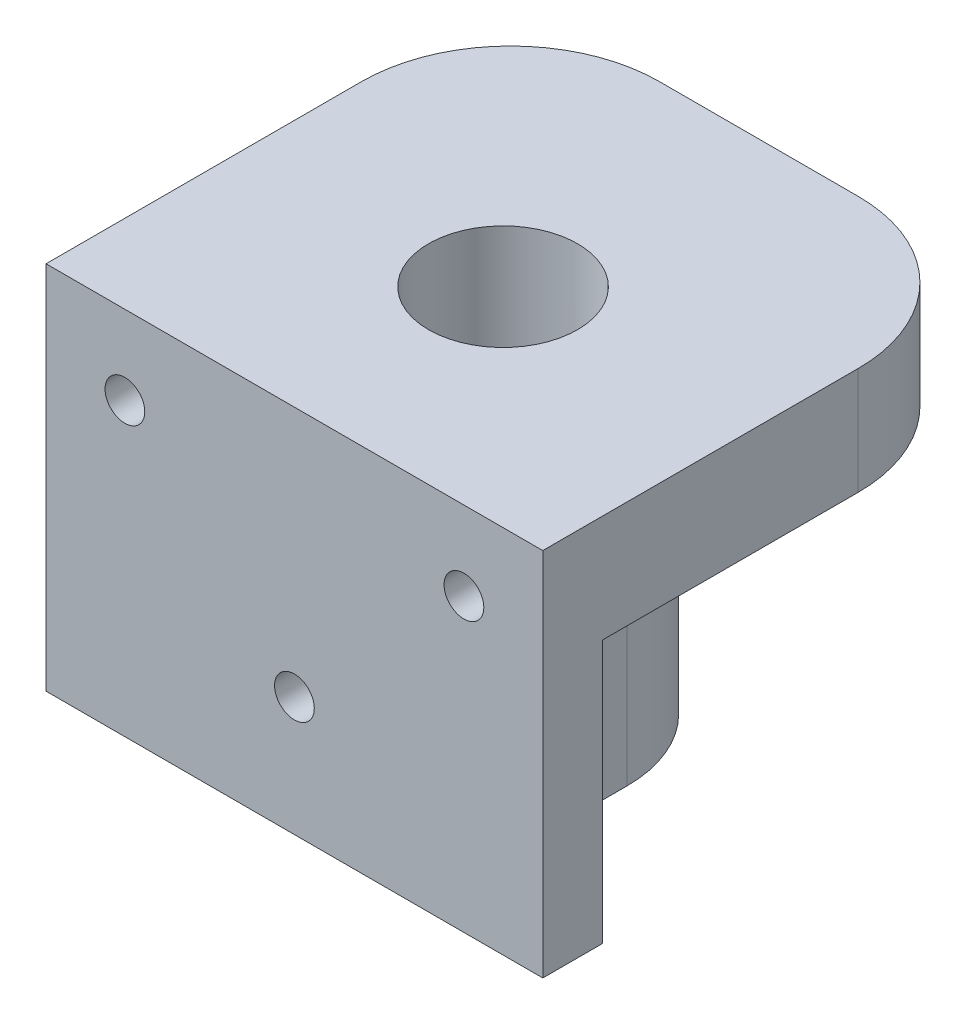
from build123d import *

# Parameters (mm, degrees)
PROFILE_SKETCH1_R                              = 7.5
PROFILE_BOSS_EXTRUDE2_DEPTH                    = 37.25987
FASTENINGHOLESKETCH3_R                         = 2
FASTENINGHOLECUT_EXTRUDE8_DEPTH                = 56.995963358
LM8UUFASTENINGHOLESKETCH5_R                    = 2
LM8UUFASTENINGHOLECUT_EXTRUDE9_DEPTH           = 56.995963425
TOPKNOTCHSKETCH2_W                             = 50
TOPKNOTCHSKETCH2_H                             = 27.5
TOPKNOTCHCUT_EXTRUDE1_DEPTH                    = 10.8
TOPSHELFSKETCH3_W                              = 50
TOPSHELFSKETCH3_H                              = 10.8
TOPSHELFBOSS_EXTRUDE1_DEPTH                    = 40.75
TOPSHELFLM8UUHOLESKETCH_R                      = 7.5
TOPSHELFLM8UUCUT_EXTRUDE2_DEPTH                = 52.733552168
FILLET3_R                                      = 15
FILLET4_R                                      = 15
RIGHTZAXISMICROSWITCHCUT_EXTRUDE1_DEPTH        = 12.05
RIGHTZAXISMICROSWITCHMOUNTINGHOLESKETCH3_R     = 1.5
RIGHTZAXISMICROSWITCHMOUNTINGHOLECUT_EXT_DEPTH = 3.1


with BuildPart() as part:
    # Profile-Sketch1 → Profile-Boss-Extrude2 (new body)
    with BuildSketch(Plane(origin=(0, 0, 0), x_dir=(1, 0, 0), z_dir=(0, 1, 0))):
        with BuildLine():
            Line((-25, -21), (25, -21))
            Line((25, -21), (25, -15))
            Line((25, -15), (22.5, -15))
            ThreePointArc((22.5, -15), (15.428932188, -12.071067812), (12.5, -5))
            Line((12.5, -5), (12.5, 0))
            ThreePointArc((12.5, 0), (0, 12.5), (-12.5, 0))
            Line((-12.5, 0), (-12.5, -5))
            ThreePointArc((-12.5, -5), (-15.428932188, -12.071067812), (-22.5, -15))
            Line((-22.5, -15), (-25, -15))
            Line((-25, -15), (-25, -21))
        make_face()
        Circle(PROFILE_SKETCH1_R, mode=Mode.SUBTRACT)
    extrude(amount=PROFILE_BOSS_EXTRUDE2_DEPTH)

    # FasteningHoleSketch3 → FasteningHoleCut-Extrude8 (cut, through all)
    with BuildSketch(Plane.XY.offset(21)):
        with Locations((-17.0625, 29.32237)):
            Circle(FASTENINGHOLESKETCH3_R)
        with Locations((17.0625, 29.32237)):
            Circle(FASTENINGHOLESKETCH3_R)
    extrude(amount=-FASTENINGHOLECUT_EXTRUDE8_DEPTH, mode=Mode.SUBTRACT)

    # LM8UUFasteningHoleSketch5 → LM8UUFasteningHoleCut-Extrude9 (cut, through all)
    with BuildSketch(Plane.XY.offset(21)):
        with Locations((0, 12)):
            Circle(LM8UUFASTENINGHOLESKETCH5_R)
    extrude(amount=-LM8UUFASTENINGHOLECUT_EXTRUDE9_DEPTH, mode=Mode.SUBTRACT)

    # TopKnotchSketch2 → TopKnotchCut-Extrude1 (cut)
    with BuildSketch(Plane(origin=(0, 37.25987, 0), x_dir=(1, 0, 0), z_dir=(0, 1, 0))):
        with Locations((0, -1.25)):
            Rectangle(TOPKNOTCHSKETCH2_W, TOPKNOTCHSKETCH2_H)
    extrude(amount=-TOPKNOTCHCUT_EXTRUDE1_DEPTH, mode=Mode.SUBTRACT)

    # TopShelfSketch3 → TopShelfBoss-Extrude1 (add)
    with BuildSketch(Plane(origin=(0, 0, 15), x_dir=(-1, 0, 0), z_dir=(0, 0, -1))):
        with Locations((0, 31.85987)):
            Rectangle(TOPSHELFSKETCH3_W, TOPSHELFSKETCH3_H)
    extrude(amount=TOPSHELFBOSS_EXTRUDE1_DEPTH)

    # TopShelfLM8UUHoleSketch → TopShelfLM8UUCut-Extrude2 (cut, through all)
    with BuildSketch(Plane(origin=(0, 37.25987, 0), x_dir=(1, 0, 0), z_dir=(0, 1, 0))):
        Circle(TOPSHELFLM8UUHOLESKETCH_R)
    extrude(amount=-TOPSHELFLM8UUCUT_EXTRUDE2_DEPTH, mode=Mode.SUBTRACT)

    # Fillet3
    fillet3_edges = [part.edges().sort_by_distance(p)[0] for p in [
        (25, 31.85987, -25.75),
    ]]
    fillet(fillet3_edges, radius=FILLET3_R)

    # Fillet4
    fillet4_edges = [part.edges().sort_by_distance(p)[0] for p in [
        (-25, 31.85987, -25.75),
    ]]
    fillet(fillet4_edges, radius=FILLET4_R)

    # RightZAxisMicroSwitchSketch2 → RightZAxisMicroSwitchCut-Extrude1 (cut)
    with BuildSketch(Plane.XZ):
        Polygon((-11.1, 0), (-13.9, 0), (-13.9, 10.086005596), (-16.342618224, 12.85), (-13.9, 12.85), (-11.1, 12.85), align=None)
    extrude(amount=-RIGHTZAXISMICROSWITCHCUT_EXTRUDE1_DEPTH, mode=Mode.SUBTRACT)

    # RightZAxisMicroSwitchMountingHoleSketch3 → RightZAxisMicroSwitchMountingHoleCut-Extrude1 (cut)
    with BuildSketch(Plane.ZY.offset(11.1)):
        with Locations((3.25, 5.05)):
            Circle(RIGHTZAXISMICROSWITCHMOUNTINGHOLESKETCH3_R)
        with Locations((9.6, 5.05)):
            Circle(RIGHTZAXISMICROSWITCHMOUNTINGHOLESKETCH3_R)
    extrude(amount=-RIGHTZAXISMICROSWITCHMOUNTINGHOLECUT_EXT_DEPTH, mode=Mode.SUBTRACT)


solid = part.part
